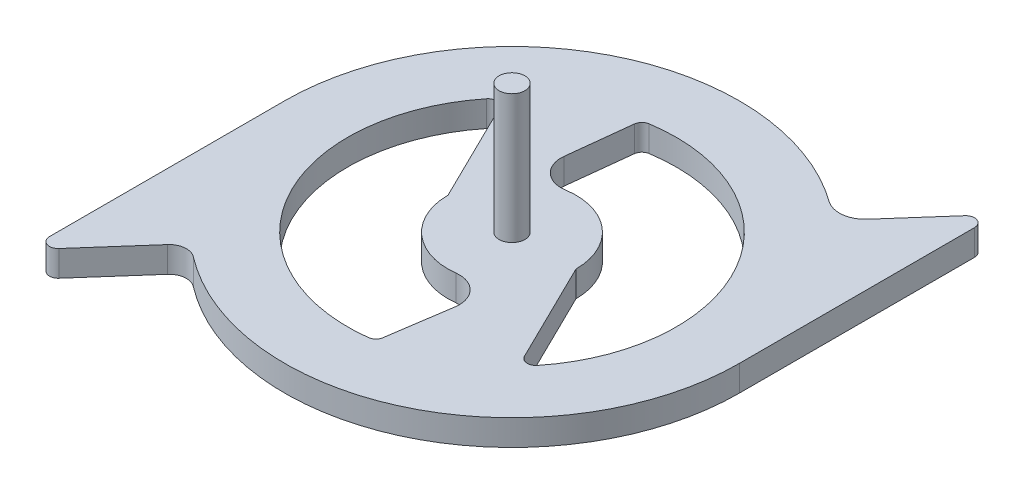
from build123d import *

# Parameters (mm, degrees)
RESSALTO_EXTRUS_O1_DEPTH = 3
FILETE2_R                = 1
FILETE3_R                = 1
FILETE4_R                = 3
FILETE5_R                = 1
FILETE6_R                = 2
FILETE8_R                = 3
FILETE9_R                = 1
FILETE10_R               = 1
FILETE11_R               = 1
FILETE12_R               = 3
ESBO_O2_R                = 1.5
RESSALTO_EXTRUS_O2_DEPTH = 15


with BuildPart() as part:
    # Esboço1 → Ressalto-extrusão1 (new body)
    with BuildSketch(Plane(origin=(0, 0, 0), x_dir=(1, 0, 0), z_dir=(0, 1, 0))):
        with BuildLine():
            Line((-26.457513111, 0), (-26.457513111, -30))
            Line((-26.457513111, -30), (-17.5, -19.843134833))
            ThreePointArc((-17.5, -19.843134833), (10.885621722, -24.114378278), (26.457513111, 0))
            Line((26.457513111, 0), (26.457513111, 30))
            Line((26.457513111, 30), (17.5, 19.843134833))
            ThreePointArc((17.5, 19.843134833), (-10.885621722, 24.114378278), (-26.457513111, 0))
        make_face()
        with BuildLine():
            Line((5.009713089, -5.505167823), (3.030153969, -18.87502089))
            ThreePointArc((3.030153969, -18.87502089), (-16.899174829, -8.936785595), (-13.894779058, 13.129484439))
            Line((-13.894779058, 13.129484439), (-7.443392908, 0))
            ThreePointArc((-7.443392908, 0), (-3.009554378, -6.80783963), (5.009713089, -5.505167823))
        make_face(mode=Mode.SUBTRACT)
        with BuildLine():
            ThreePointArc((13.894779058, -13.129484439), (16.738722413, 9.233819289), (-3.694798692, 18.756244542))
            Line((-3.694798692, 18.756244542), (-5.200992817, 5.324825979))
            ThreePointArc((-5.200992817, 5.324825979), (2.888863526, 6.8599246), (7.443392908, 0))
            Line((7.443392908, 0), (13.894779058, -13.129484439))
        make_face(mode=Mode.SUBTRACT)
    extrude(amount=RESSALTO_EXTRUS_O1_DEPTH)

    # Filete2
    filete2_edges = [part.edges().sort_by_distance(p)[0] for p in [
        (26.457513111, 1.5, -30),
    ]]
    fillet(filete2_edges, radius=FILETE2_R)

    # Filete3
    filete3_edges = [part.edges().sort_by_distance(p)[0] for p in [
        (-26.457513111, 1.5, 30),
    ]]
    fillet(filete3_edges, radius=FILETE3_R)

    # Filete4
    filete4_edges = [part.edges().sort_by_distance(p)[0] for p in [
        (-5.200992817, 1.5, -5.324825979),
    ]]
    fillet(filete4_edges, radius=FILETE4_R)

    # Filete5
    filete5_edges = [part.edges().sort_by_distance(p)[0] for p in [
        (-3.694798692, 1.5, -18.756244542),
    ]]
    fillet(filete5_edges, radius=FILETE5_R)

    # Filete6
    filete6_edges = [part.edges().sort_by_distance(p)[0] for p in [
        (-17.5, 1.5, 19.843134833),
    ]]
    fillet(filete6_edges, radius=FILETE6_R)

    # Filete8
    filete8_edges = [part.edges().sort_by_distance(p)[0] for p in [
        (5.009713089, 1.5, 5.505167823),
    ]]
    fillet(filete8_edges, radius=FILETE8_R)

    # Filete9
    filete9_edges = [part.edges().sort_by_distance(p)[0] for p in [
        (3.030153969, 1.5, 18.87502089),
    ]]
    fillet(filete9_edges, radius=FILETE9_R)

    # Filete10
    filete10_edges = [part.edges().sort_by_distance(p)[0] for p in [
        (13.894779058, 1.5, 13.129484439),
    ]]
    fillet(filete10_edges, radius=FILETE10_R)

    # Filete11
    filete11_edges = [part.edges().sort_by_distance(p)[0] for p in [
        (-13.894779058, 1.5, -13.129484439),
    ]]
    fillet(filete11_edges, radius=FILETE11_R)

    # Filete12
    filete12_edges = [part.edges().sort_by_distance(p)[0] for p in [
        (17.5, 1.5, -19.843134833),
    ]]
    fillet(filete12_edges, radius=FILETE12_R)

    # Esboço2 → Ressalto-extrusão2 (add)
    with BuildSketch(Plane(origin=(0, 3, 0), x_dir=(1, 0, 0), z_dir=(0, 1, 0))):
        Circle(ESBO_O2_R)
    extrude(amount=RESSALTO_EXTRUS_O2_DEPTH)


solid = part.part
